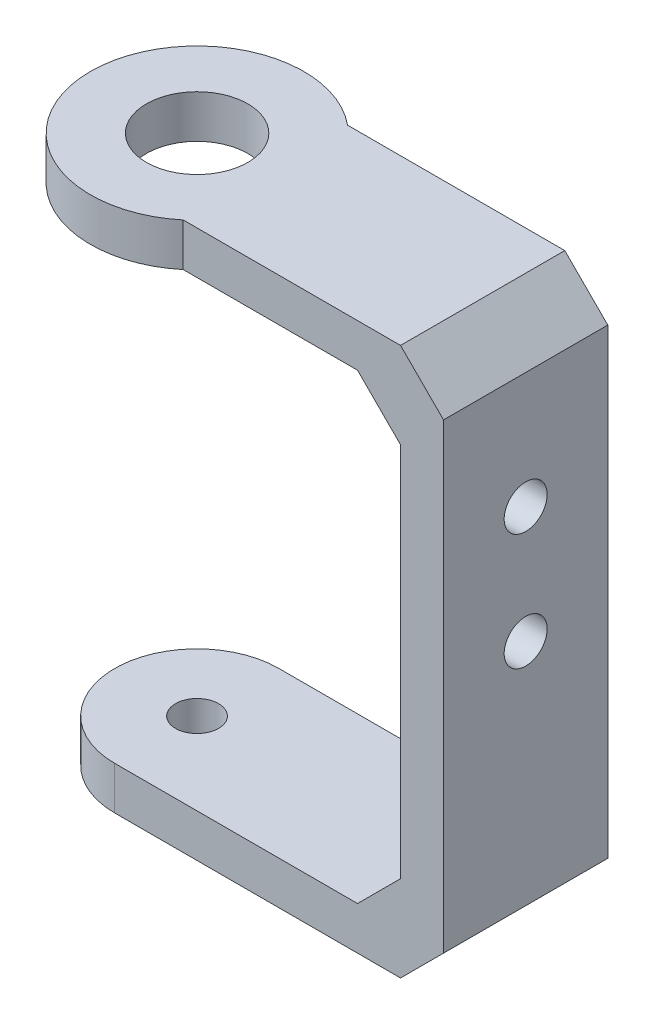
from build123d import *
from OCP.BRepAlgoAPI import BRepAlgoAPI_Cut
from OCP.TopTools import TopTools_ListOfShape

# Parameters (mm, degrees)
BOSS_EXTRUDE1_DEPTH      = 5.73
BOSS_EXTRUDE1_DEPTH_BACK = 5.73
BOSS_EXTRUDE5_DEPTH      = 11.46
BOSS_EXTRUDE8_DEPTH      = 11.46
BOSS_EXTRUDE9_DEPTH      = 3
SKETCH11_R               = 3.54
CUT_EXTRUDE1_DEPTH       = 3
BOSS_EXTRUDE10_DEPTH     = 3
SKETCH13_R               = 1.5
CUT_EXTRUDE2_DEPTH       = 3
CUT_EXTRUDE3_START       = -3.000002
SKETCH15_R               = 1.5
CUT_EXTRUDE3_DEPTH       = 3.000002


with BuildPart() as part:
    # Sketch1 → Boss-Extrude1 (new, two sides: drawn at the far end of the back side and taken through both)
    with BuildSketch(Plane.XY.offset(-BOSS_EXTRUDE1_DEPTH_BACK)):
        Polygon((23.736099909, 38.996836219), (26.736100401, 35.996833865), (26.736100401, 3.776835326), (23.736098978, 0.776835766), (20.736098486, 3.77683812), (23.736098978, 6.776836749), (23.736098978, 32.99683803), (20.736100349, 35.996838521), align=None)
    extrude(amount=BOSS_EXTRUDE1_DEPTH + BOSS_EXTRUDE1_DEPTH_BACK)

    # Sketch6 → Boss-Extrude5 (add)
    with BuildSketch(Plane.XY.offset(5.73)):
        Polygon((20.736098486, 3.77683812), (8.576098486, 3.77683812), (8.576098486, 0.776835766), (20.736098486, 0.776835766), (23.736098978, 0.776835766), align=None)
    extrude(amount=-BOSS_EXTRUDE5_DEPTH)

    # Sketch8 → Boss-Extrude8 (add)
    with BuildSketch(Plane.XY.offset(5.73)):
        Polygon((20.736100349, 38.996836219), (23.736099909, 38.996836219), (20.736100349, 35.996838521), (8.576100349, 35.996838521), (8.576100349, 38.996836219), align=None)
    extrude(amount=-BOSS_EXTRUDE8_DEPTH)

    # Sketch9 → Boss-Extrude9 (add)
    with BuildSketch(Plane(origin=(0, 38.996836219, 0), x_dir=(1, 0, 0), z_dir=(0, 1, 0))):
        with BuildLine():
            Line((8.576100349, 5.73), (8.576100349, -5.73))
            ThreePointArc((8.576100349, -5.73), (-3.635159989, 0), (8.576100349, 5.73))
        make_face()
    extrude(amount=-BOSS_EXTRUDE9_DEPTH)

    # Sketch11 → Cut-Extrude1 (cut)
    with BuildSketch(Plane(origin=(0, 38.996836219, 0), x_dir=(1, 0, 0), z_dir=(0, 1, 0))):
        with Locations(Location((3.814840011, 0, 0), (0, 0, 270))):
            Circle(SKETCH11_R)
    extrude(amount=-CUT_EXTRUDE1_DEPTH, mode=Mode.SUBTRACT)

    # Sketch12 → Boss-Extrude10 (add)
    with BuildSketch(Plane(origin=(0, 0.776835766, 0), x_dir=(-1, 0, 0), z_dir=(0, -1, 0))):
        with BuildLine():
            Line((-8.576098486, 5.73), (-3.793078174, 5.73))
            ThreePointArc((-3.793078174, 5.73), (1.936921826, 0), (-3.793078174, -5.73))
            Line((-3.793078174, -5.73), (-8.576098486, -5.73))
            Line((-8.576098486, -5.73), (-8.576098486, 5.73))
        make_face()
    extrude(amount=-BOSS_EXTRUDE10_DEPTH)


with BuildPart() as cut_extrude2_tool:
    # Sketch13 → Cut-Extrude2 (new body)
    with BuildSketch(Plane(origin=(0, 3.77683812, 0), x_dir=(1, 0, 0), z_dir=(0, 1, 0))):
        with Locations(Location((3.81, 0, 0), (0, 0, 180))):
            Circle(SKETCH13_R)
    extrude(amount=-CUT_EXTRUDE2_DEPTH)


with BuildPart() as part_1:
    add(part.part)

    # Cut-Extrude2: cut by cut_extrude2_tool, with a tolerance
    cut_extrude2_stock = TopTools_ListOfShape()
    cut_extrude2_stock.Append(part_1.part.wrapped)
    cut_extrude2_tools = TopTools_ListOfShape()
    cut_extrude2_tools.Append(cut_extrude2_tool.part.wrapped)
    cut_extrude2_cut = BRepAlgoAPI_Cut()
    cut_extrude2_cut.SetArguments(cut_extrude2_stock)
    cut_extrude2_cut.SetTools(cut_extrude2_tools)
    cut_extrude2_cut.SetFuzzyValue(0.00001)
    cut_extrude2_cut.Build()
    add(Compound.cast(cut_extrude2_cut.Shape()).solids(), mode=Mode.REPLACE)

    # Sketch15 → Cut-Extrude3 (cut)
    with BuildSketch(Plane(origin=(26.736100401, 0, 0), x_dir=(0, 0, -1), z_dir=(1, 0, 0)).offset(CUT_EXTRUDE3_START)):
        with Locations(Location((0, 27.886833865, 0), (0, 0, 90))):
            Circle(SKETCH15_R)
        with Locations(Location((0, 19.756835766, 0), (0, 0, 90))):
            Circle(SKETCH15_R)
    extrude(amount=CUT_EXTRUDE3_DEPTH, mode=Mode.SUBTRACT)


solid = part_1.part
